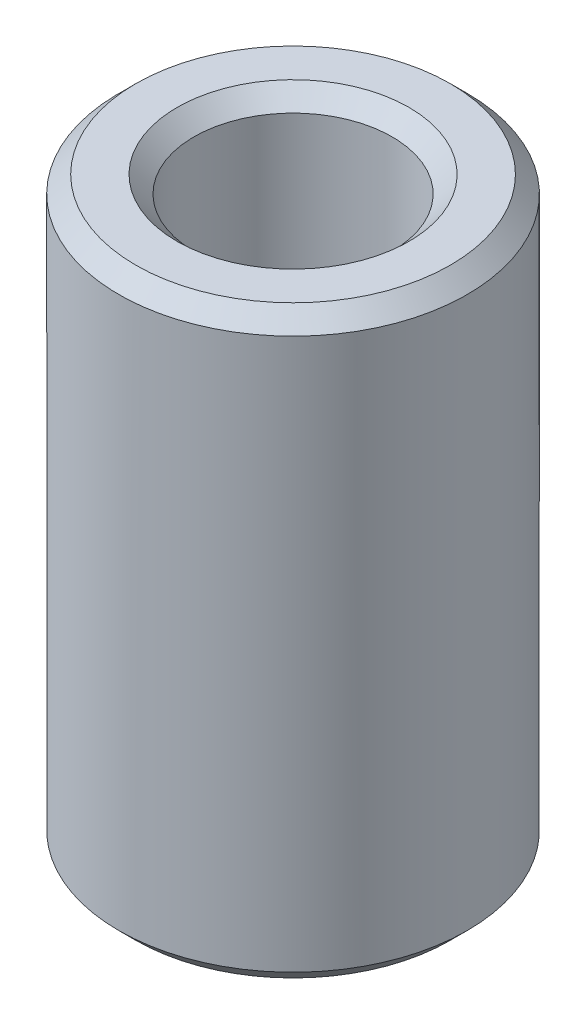
from build123d import *

# Parameters (mm, degrees)
SKETCH1_R           = 40
BOSS_EXTRUDE1_DEPTH = 134.267300218
SKETCH2_R           = 22.749224503
CUT_EXTRUDE1_DEPTH  = 146.697316062
CHAMFER1_SIZE       = 3.891758612


with BuildPart() as part:
    # Sketch1 → Boss-Extrude1 (new body)
    with BuildSketch(Plane(origin=(0, 0, 0), x_dir=(1, 0, 0), z_dir=(0, 1, 0))):
        Circle(SKETCH1_R)
    extrude(amount=BOSS_EXTRUDE1_DEPTH)

    # Sketch2 → Cut-Extrude1 (cut, through all)
    with BuildSketch(Plane(origin=(0, 0, 0), x_dir=(1, 0, 0), z_dir=(0, 1, 0))):
        Circle(SKETCH2_R)
    extrude(amount=CUT_EXTRUDE1_DEPTH, mode=Mode.SUBTRACT)

    # Chamfer1
    chamfer1_edges = [part.edges().sort_by_distance(p)[0] for p in [
        (-22.749224503, 134.267300218, 0),
        (-22.749224503, 0, 0),
        (-40, 0, 0),
        (-40, 134.267300218, 0),
    ]]
    chamfer(chamfer1_edges, length=CHAMFER1_SIZE)


solid = part.part
